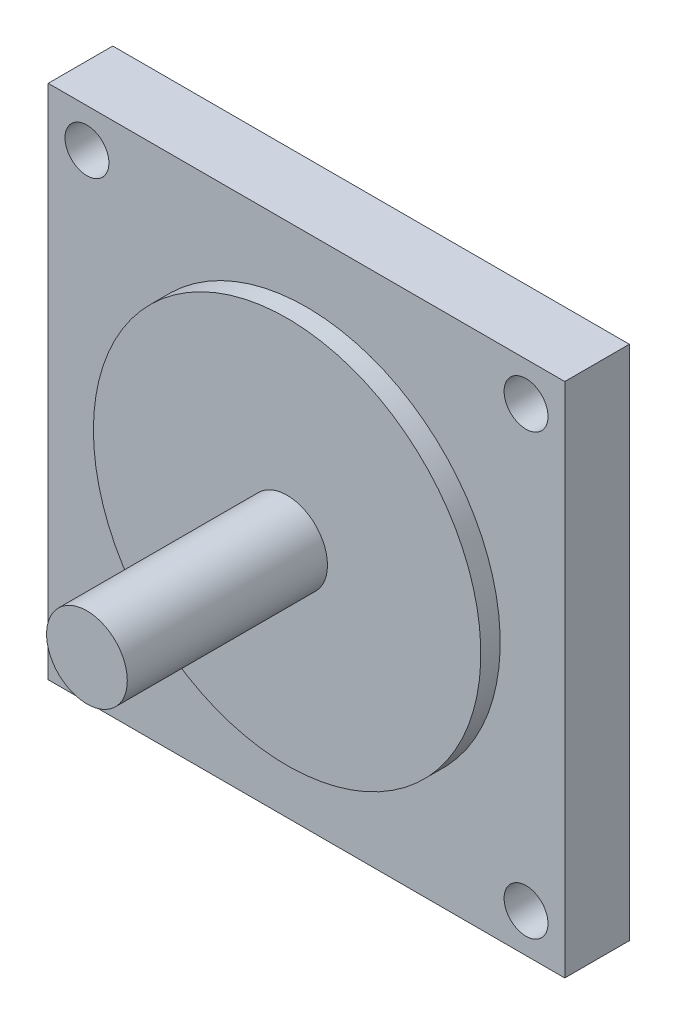
from build123d import *

# Parameters (mm, degrees)
SKETCH1_W           = 101.6
SKETCH1_H           = 101.6
SKETCH1_R           = 4.318
BOSS_EXTRUDE1_DEPTH = 12.7
SKETCH2_R           = 38.1
BOSS_EXTRUDE2_DEPTH = 3.81
SKETCH4_R           = 7.9375
BOSS_EXTRUDE4_DEPTH = 39.37


with BuildPart() as part:
    # Sketch1 → Boss-Extrude1 (new body)
    with BuildSketch(Plane.XY):
        Rectangle(SKETCH1_W, SKETCH1_H)
        with Locations((-43.18, -43.18)):
            Circle(SKETCH1_R, mode=Mode.SUBTRACT)
        with Locations((43.18, -43.18)):
            Circle(SKETCH1_R, mode=Mode.SUBTRACT)
        with Locations((43.18, 43.18)):
            Circle(SKETCH1_R, mode=Mode.SUBTRACT)
        with Locations((-43.18, 43.18)):
            Circle(SKETCH1_R, mode=Mode.SUBTRACT)
    extrude(amount=BOSS_EXTRUDE1_DEPTH)

    # Sketch2 → Boss-Extrude2 (add)
    with BuildSketch(Plane.XY.offset(12.7)):
        Circle(SKETCH2_R)
    extrude(amount=BOSS_EXTRUDE2_DEPTH)

    # Sketch4 → Boss-Extrude4 (add)
    with BuildSketch(Plane.XY.offset(16.51)):
        Circle(SKETCH4_R)
    extrude(amount=BOSS_EXTRUDE4_DEPTH)


solid = part.part
